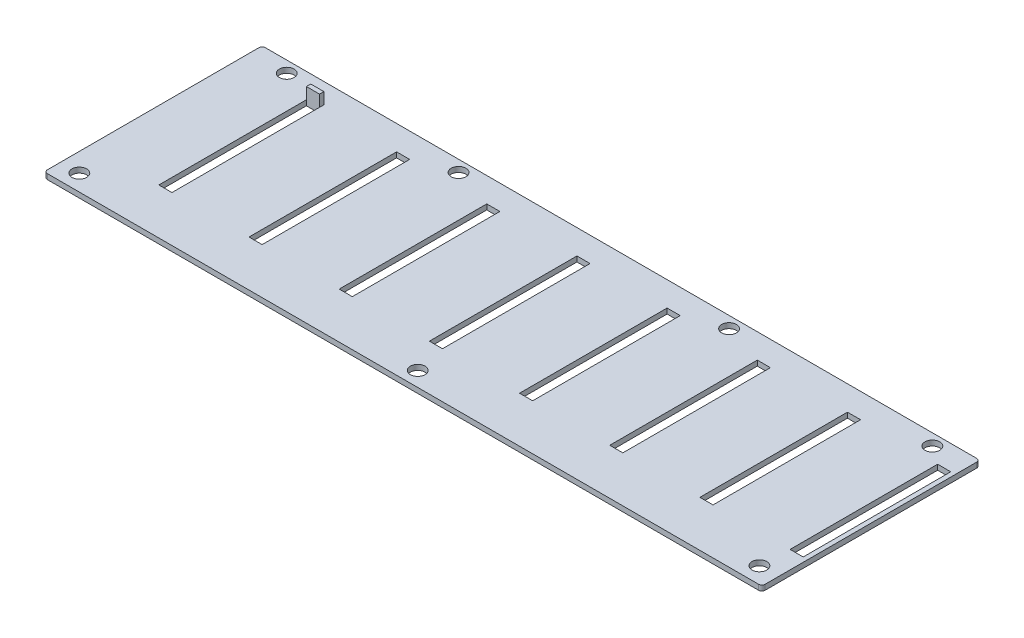
from build123d import *

# Parameters (mm, degrees)
SKETCH1_W           = 218.9
SKETCH1_H           = 66.5
SKETCH1_R           = 2.25
SKETCH1_W_2         = 4
SKETCH1_H_2         = 45
BOSS_EXTRUDE1_DEPTH = 1.6
FILLET1_R           = 1
SKETCH3_W           = 4
SKETCH3_H           = 1.331639971
BOSS_EXTRUDE2_DEPTH = 5.1


with BuildPart() as part:
    # Sketch1 → Boss-Extrude1 (new body)
    with BuildSketch(Plane(origin=(0, 0, 0), x_dir=(1, 0, 0), z_dir=(0, 1, 0))):
        with Locations((109.45, 33.25)):
            Rectangle(SKETCH1_W, SKETCH1_H)
        with Locations((11, 63)):
            Circle(SKETCH1_R, mode=Mode.SUBTRACT)
        with Locations((63.4, 63)):
            Circle(SKETCH1_R, mode=Mode.SUBTRACT)
        with Locations((145.9, 63)):
            Circle(SKETCH1_R, mode=Mode.SUBTRACT)
        with Locations((207.9, 63)):
            Circle(SKETCH1_R, mode=Mode.SUBTRACT)
        with Locations((5.75, 5)):
            Circle(SKETCH1_R, mode=Mode.SUBTRACT)
        with Locations((109.45, 4.5)):
            Circle(SKETCH1_R, mode=Mode.SUBTRACT)
        with Locations((213.15, 5)):
            Circle(SKETCH1_R, mode=Mode.SUBTRACT)
        with Locations((23, 36.5)):
            Rectangle(SKETCH1_W_2, SKETCH1_H_2, mode=Mode.SUBTRACT)
        with Locations((50.5, 36.5)):
            Rectangle(SKETCH1_W_2, SKETCH1_H_2, mode=Mode.SUBTRACT)
        with Locations((78, 36.5)):
            Rectangle(SKETCH1_W_2, SKETCH1_H_2, mode=Mode.SUBTRACT)
        with Locations((105.5, 36.5)):
            Rectangle(SKETCH1_W_2, SKETCH1_H_2, mode=Mode.SUBTRACT)
        with Locations((133, 36.5)):
            Rectangle(SKETCH1_W_2, SKETCH1_H_2, mode=Mode.SUBTRACT)
        with Locations((160.5, 36.5)):
            Rectangle(SKETCH1_W_2, SKETCH1_H_2, mode=Mode.SUBTRACT)
        with Locations((188, 36.5)):
            Rectangle(SKETCH1_W_2, SKETCH1_H_2, mode=Mode.SUBTRACT)
        with Locations((215.5, 36.5)):
            Rectangle(SKETCH1_W_2, SKETCH1_H_2, mode=Mode.SUBTRACT)
    extrude(amount=BOSS_EXTRUDE1_DEPTH)

    # Fillet1
    fillet1_edges = [part.edges().sort_by_distance(p)[0] for p in [
        (218.9, 0.8, -66.5),
        (218.9, 0.8, 0),
        (0, 0.8, 0),
        (0, 0.8, -66.5),
    ]]
    fillet(fillet1_edges, radius=FILLET1_R)

    # Sketch3 → Boss-Extrude2 (add)
    with BuildSketch(Plane(origin=(0, 0, 0), x_dir=(1, 0, 0), z_dir=(0, 1, 0))):
        with Locations((23, 59.665819986)):
            Rectangle(SKETCH3_W, SKETCH3_H)
    extrude(amount=BOSS_EXTRUDE2_DEPTH)


solid = part.part
